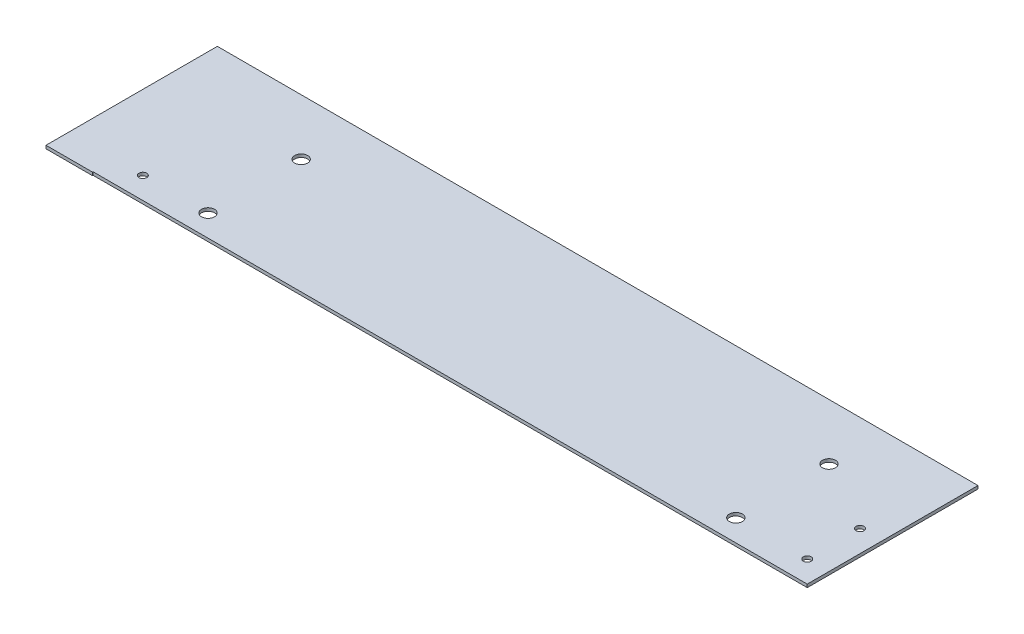
from build123d import *

# Parameters (mm, degrees)
SKETCH_1_W      = 230
SKETCH_1_H      = 1
EXTRUDE_1_DEPTH = 15
M3X0_5_1_D      = 2.5
M5X0_8_1_D      = 4.2
SKETCH_10_W     = 20
SKETCH_10_H     = 1
EXTRUDE_3_DEPTH = 40
SKETCH_11_W     = 40
SKETCH_11_H     = 1
EXTRUDE_4_DEPTH = 40
M5X0_8_3_D      = 4.2
SKETCH_15_W     = 40
SKETCH_15_H     = 1
EXTRUDE_6_DEPTH = 150
SKETCH_16_W     = 40
SKETCH_16_H     = 1
EXTRUDE_7_DEPTH = 20
SKETCH_18_W     = 55.188672214
SKETCH_18_H     = 1
EXTRUDE_9_DEPTH = 15
M3X0_5_2_D      = 2.5
M3X0_5_2_DEPTH  = 8.5
M3X0_5_2_TIP    = 0.751075774


with BuildPart() as part:
    # ｽｹｯﾁ1 → ﾎﾞｽ - 押し出し1 (new body)
    with BuildSketch(Plane.XY):
        with Locations((115, 0.5)):
            Rectangle(SKETCH_1_W, SKETCH_1_H)
    extrude(amount=EXTRUDE_1_DEPTH)

    # M3x0.5 ねじ穴1 (through all)
    with Locations(Plane(origin=(0, 0, 0), x_dir=(-1, 0, 0), z_dir=(0, -1, 0))):
        with Locations((-9, -8), (-223, -8)):
            Hole(M3X0_5_1_D / 2)

    # M5x0.8 ねじ穴1 (through all)
    with Locations(Plane(origin=(0, 1, 0), x_dir=(1, 0, 0), z_dir=(0, 1, 0))):
        with Locations((30, -8), (200, -8)):
            Hole(M5X0_8_1_D / 2)

    # ｽｹｯﾁ10 → ﾎﾞｽ - 押し出し3 (add)
    with BuildSketch(Plane(origin=(0, 0, 0), x_dir=(-1, 0, 0), z_dir=(0, 0, -1))):
        with Locations((-200, 0.5)):
            Rectangle(SKETCH_10_W, SKETCH_10_H)
    extrude(amount=EXTRUDE_3_DEPTH)

    # ｽｹｯﾁ11 → ﾎﾞｽ - 押し出し4 (add)
    with BuildSketch(Plane(origin=(0, 0, 0), x_dir=(-1, 0, 0), z_dir=(0, 0, -1))):
        with Locations((-20, 0.5)):
            Rectangle(SKETCH_11_W, SKETCH_11_H)
    extrude(amount=EXTRUDE_4_DEPTH)

    # M5x0.8 ねじ穴3 (through all)
    with Locations(Plane(origin=(0, 1, 0), x_dir=(1, 0, 0), z_dir=(0, 1, 0))):
        with Locations((30, 22), (200, 22)):
            Hole(M5X0_8_3_D / 2)

    # ｽｹｯﾁ15 → ﾎﾞｽ - 押し出し6 (add)
    with BuildSketch(Plane(origin=(40, 0, 0), x_dir=(0, 0, -1), z_dir=(1, 0, 0))):
        with Locations((20, 0.5)):
            Rectangle(SKETCH_15_W, SKETCH_15_H)
    extrude(amount=EXTRUDE_6_DEPTH)

    # ｽｹｯﾁ16 → ﾎﾞｽ - 押し出し7 (add)
    with BuildSketch(Plane(origin=(210, 0, 0), x_dir=(0, 0, -1), z_dir=(1, 0, 0))):
        with Locations((20, 0.5)):
            Rectangle(SKETCH_16_W, SKETCH_16_H)
    extrude(amount=EXTRUDE_7_DEPTH)

    # ｽｹｯﾁ18 → ﾎﾞｽ - 押し出し9 (add)
    with BuildSketch(Plane.ZY):
        with Locations((-12.405663893, 0.5)):
            Rectangle(SKETCH_18_W, SKETCH_18_H)
    extrude(amount=EXTRUDE_9_DEPTH)

    # M3x0.5 ねじ穴2
    with Locations(Plane(origin=(0, 0, 0), x_dir=(-1, 0, 0), z_dir=(0, -1, 0))):
        with Locations((-223, 9)):
            Hole(M3X0_5_2_D / 2, depth=M3X0_5_2_DEPTH)
            with Locations((0, 0, -(M3X0_5_2_DEPTH + M3X0_5_2_TIP / 2))):  # 118° drill point
                Cone(0, M3X0_5_2_D / 2, M3X0_5_2_TIP, mode=Mode.SUBTRACT)


solid = part.part
